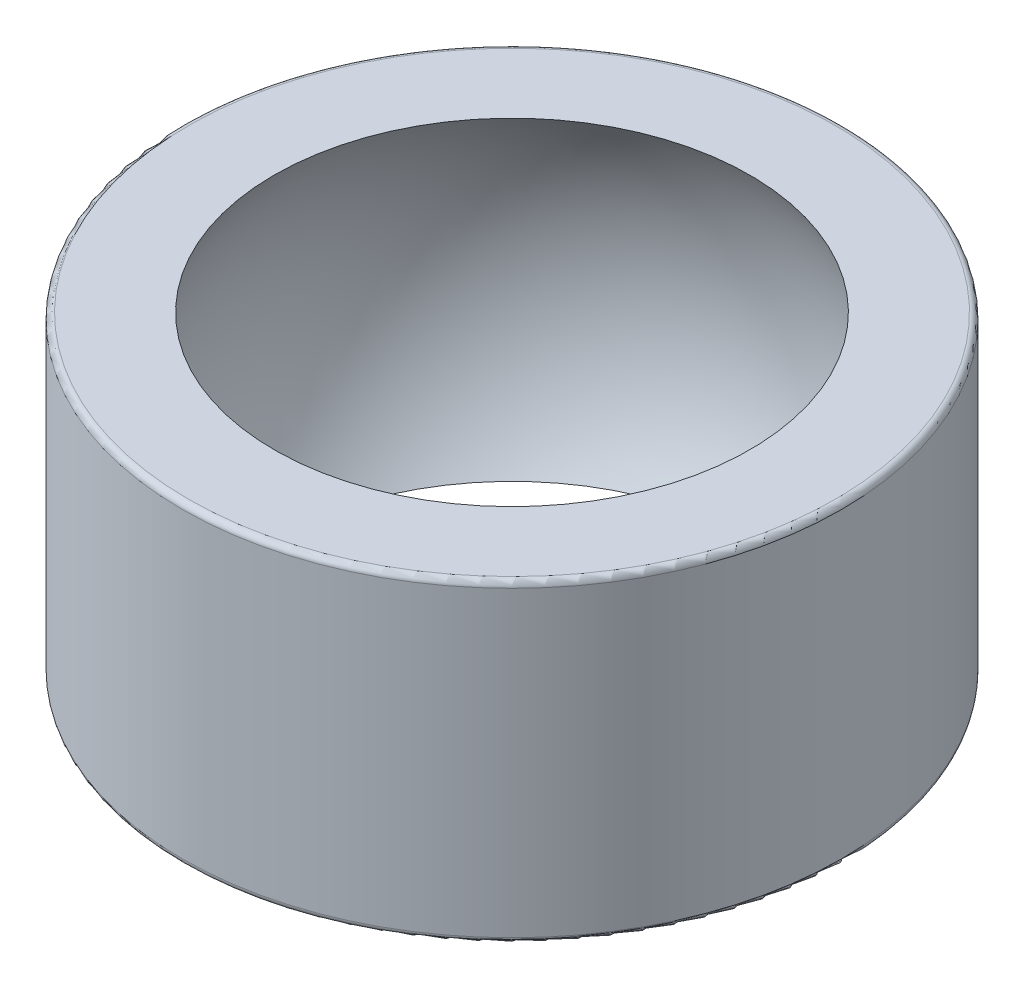
from build123d import *

# Parameters (mm, degrees)
SZKIC1_R                    = 11
DODANIE_WYCI_GNI_CIE1_DEPTH = 5.25
ZAOKR_GLENIE1_R             = 0.2


with BuildPart() as part:
    # Szkic1 → Dodanie-wyciągnięcie1 (new, symmetric)
    with BuildSketch(Plane(origin=(0, 0, 0), x_dir=(1, 0, 0), z_dir=(0, 1, 0))):
        Circle(SZKIC1_R)
    extrude(amount=DODANIE_WYCI_GNI_CIE1_DEPTH, both=True)

    # Szkic3 → Wycięcie-obrót1 (revolve, cut)
    with BuildSketch(Plane.XY):
        with BuildLine():
            Line((0, -9.52), (0, 9.52))
            ThreePointArc((0, 9.52), (9.52, 0), (0, -9.52))
        make_face()
    revolve(axis=Axis((0, -9.52, 0), (0, 1, 0)), mode=Mode.SUBTRACT)

    # Zaokrąglenie1
    zaokr_glenie1_edges = [part.edges().sort_by_distance(p)[0] for p in [
        (-11, 5.25, 0),
        (-11, -5.25, 0),
    ]]
    fillet(zaokr_glenie1_edges, radius=ZAOKR_GLENIE1_R)


solid = part.part
